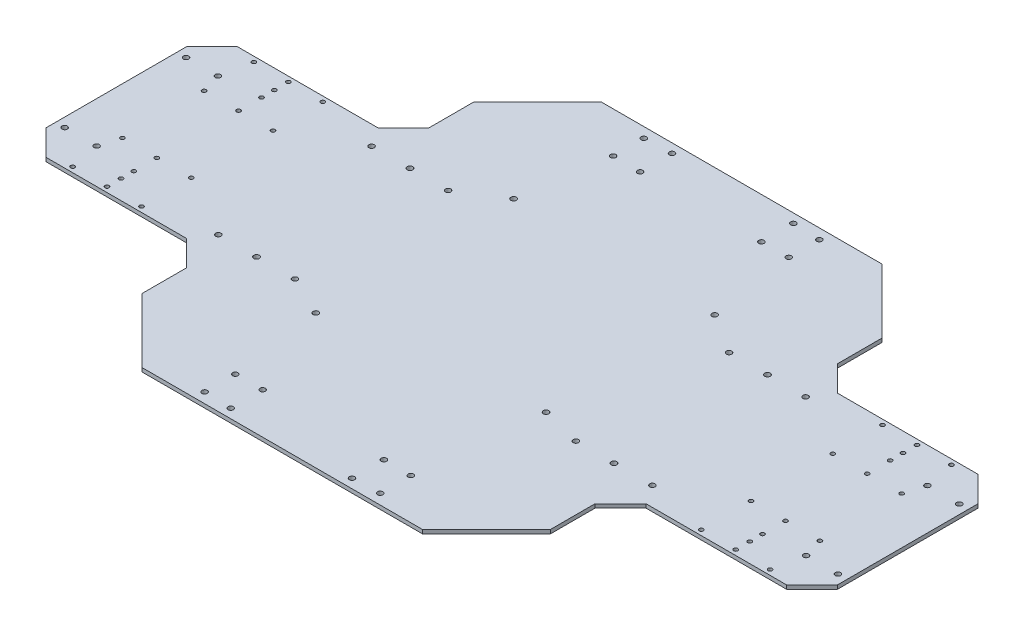
from build123d import *

# Parameters (mm, degrees)
EXTRUDE_1_DEPTH     = 3
CHAMFER_1_SIZE      = 20
SKETCH_2_W          = 320
SKETCH_2_H          = 20
CUT_EXTRUDE_1_DEPTH = 5
CHAMFER_2_SIZE      = 50
SKETCH_3_R          = 2.1
CUT_EXTRUDE_2_DEPTH = 80
SKETCH_4_R          = 2.15
CUT_EXTRUDE_3_DEPTH = 10
SKETCH_5_R          = 1.6
SKETCH_5_R_2        = 2.1
SKETCH_5_R_3        = 2.2
CUT_EXTRUDE_4_DEPTH = 29


with BuildPart() as part:
    # 草图1 → 凸台-拉伸1 (new body)
    with BuildSketch(Plane(origin=(0, 0, 0), x_dir=(1, 0, 0), z_dir=(0, 1, 0))):
        Polygon((-310, -75), (-160, -75), (-160, -200), (160, -200), (160, -75), (310, -75), (310, 75), (160, 75), (160, 200), (-160, 200), (-160, 75), (-310, 75), align=None)
    extrude(amount=EXTRUDE_1_DEPTH)

    # 倒角1
    chamfer_1_edges = [part.edges().sort_by_distance(p)[0] for p in [
        (-160, 1.5, -75),
        (-310, 1.5, -75),
        (-310, 1.5, 75),
        (-160, 1.5, 75),
        (160, 1.5, 75),
        (160, 1.5, -75),
        (310, 1.5, 75),
        (310, 1.5, -75),
    ]]
    chamfer(chamfer_1_edges, length=CHAMFER_1_SIZE)

    # 草图2 → 切除-拉伸1 (cut)
    with BuildSketch(Plane(origin=(0, 3, 0), x_dir=(1, 0, 0), z_dir=(0, 1, 0))):
        with Locations((0, 190)):
            Rectangle(SKETCH_2_W, SKETCH_2_H)
        with Locations((0, -190)):
            Rectangle(SKETCH_2_W, SKETCH_2_H)
    extrude(amount=-CUT_EXTRUDE_1_DEPTH, mode=Mode.SUBTRACT)

    # 倒角2
    chamfer_2_edges = [part.edges().sort_by_distance(p)[0] for p in [
        (-160, 1.5, -180),
        (-160, 1.5, 180),
        (160, 1.5, -180),
        (160, 1.5, 180),
    ]]
    chamfer(chamfer_2_edges, length=CHAMFER_2_SIZE)

    # 草图3 → 切除-拉伸2 (cut)
    with BuildSketch(Plane(origin=(0, 3, 0), x_dir=(1, 0, 0), z_dir=(0, 1, 0))):
        with Locations((-302.826293853, 47.5)):
            Circle(SKETCH_3_R)
        with Locations((-277.826293853, 47.5)):
            Circle(SKETCH_3_R)
        with Locations((-47.5, 172.826293853)):
            Circle(SKETCH_3_R)
        with Locations((-47.5, 147.826293853)):
            Circle(SKETCH_3_R)
        with Locations((47.5, 172.826293853)):
            Circle(SKETCH_3_R)
        with Locations((47.5, 147.826293853)):
            Circle(SKETCH_3_R)
        with Locations((277.826293853, 47.5)):
            Circle(SKETCH_3_R)
        with Locations((302.826293853, 47.5)):
            Circle(SKETCH_3_R)
        with Locations((-68.75, 172)):
            Circle(SKETCH_3_R)
        with Locations((-68.75, 148)):
            Circle(SKETCH_3_R)
        with Locations((68.75, 172)):
            Circle(SKETCH_3_R)
        with Locations((68.75, 148)):
            Circle(SKETCH_3_R)
        with Locations((68.75, -148)):
            Circle(SKETCH_3_R)
        with Locations((68.75, -172)):
            Circle(SKETCH_3_R)
        with Locations((-68.75, -148)):
            Circle(SKETCH_3_R)
        with Locations((-68.75, -172)):
            Circle(SKETCH_3_R)
        with Locations((302.826293853, -47.5)):
            Circle(SKETCH_3_R)
        with Locations((277.826293853, -47.5)):
            Circle(SKETCH_3_R)
        with Locations((47.5, -147.826293853)):
            Circle(SKETCH_3_R)
        with Locations((47.5, -172.826293853)):
            Circle(SKETCH_3_R)
        with Locations((-47.5, -147.826293853)):
            Circle(SKETCH_3_R)
        with Locations((-47.5, -172.826293853)):
            Circle(SKETCH_3_R)
        with Locations((-277.826293853, -47.5)):
            Circle(SKETCH_3_R)
        with Locations((-302.826293853, -47.5)):
            Circle(SKETCH_3_R)
    extrude(amount=-CUT_EXTRUDE_2_DEPTH, mode=Mode.SUBTRACT)

    # 草图4 → 切除-拉伸3 (cut)
    with BuildSketch(Plane.XZ):
        with Locations((-78.739999994, 74.909999989)):
            Circle(SKETCH_4_R)
        with Locations((-78.739999994, -80.01)):
            Circle(SKETCH_4_R)
        with Locations((78.740000006, -80.01)):
            Circle(SKETCH_4_R)
        with Locations((78.740000006, 52.07)):
            Circle(SKETCH_4_R)
    extrude(amount=-CUT_EXTRUDE_3_DEPTH, mode=Mode.SUBTRACT)

    # 草图5 → 切除-拉伸4 (cut)
    with BuildSketch(Plane(origin=(0, 3, 0), x_dir=(1, 0, 0), z_dir=(0, 1, 0))):
        with Locations((219.200177837, 71)):
            Circle(SKETCH_5_R)
        with Locations((273.200177837, 71)):
            Circle(SKETCH_5_R)
        with Locations((246.200177837, 71)):
            Circle(SKETCH_5_R)
        with Locations((219.200177837, 31.998400192)):
            Circle(SKETCH_5_R)
        with Locations((246.200177837, 31.998400192)):
            Circle(SKETCH_5_R)
        with Locations((273.200177837, 31.998400192)):
            Circle(SKETCH_5_R)
        with Locations((246.200177837, 60)):
            Circle(SKETCH_5_R)
        with Locations((246.200177837, 50)):
            Circle(SKETCH_5_R)
        with Locations((246.200177837, -50)):
            Circle(SKETCH_5_R)
        with Locations((246.200177837, -60)):
            Circle(SKETCH_5_R)
        with Locations((273.200177837, -31.998400192)):
            Circle(SKETCH_5_R)
        with Locations((246.200177837, -31.998400192)):
            Circle(SKETCH_5_R)
        with Locations((219.200177837, -31.998400192)):
            Circle(SKETCH_5_R)
        with Locations((246.200177837, -71)):
            Circle(SKETCH_5_R)
        with Locations((273.200177837, -71)):
            Circle(SKETCH_5_R)
        with Locations((219.200177837, -71)):
            Circle(SKETCH_5_R)
        with Locations((-219.200177837, -71)):
            Circle(SKETCH_5_R)
        with Locations((-273.200177837, -71)):
            Circle(SKETCH_5_R)
        with Locations((-246.200177837, -71)):
            Circle(SKETCH_5_R)
        with Locations((-219.200177837, -31.998400192)):
            Circle(SKETCH_5_R)
        with Locations((-246.200177837, -31.998400192)):
            Circle(SKETCH_5_R)
        with Locations((-273.200177837, -31.998400192)):
            Circle(SKETCH_5_R)
        with Locations((-246.200177837, -60)):
            Circle(SKETCH_5_R)
        with Locations((-246.200177837, -50)):
            Circle(SKETCH_5_R)
        with Locations((-246.200177837, 50)):
            Circle(SKETCH_5_R)
        with Locations((-246.200177837, 60)):
            Circle(SKETCH_5_R)
        with Locations((-273.200177837, 31.998400192)):
            Circle(SKETCH_5_R)
        with Locations((-246.200177837, 31.998400192)):
            Circle(SKETCH_5_R)
        with Locations((-219.200177837, 31.998400192)):
            Circle(SKETCH_5_R)
        with Locations((-246.200177837, 71)):
            Circle(SKETCH_5_R)
        with Locations((-273.200177837, 71)):
            Circle(SKETCH_5_R)
        with Locations((-219.200177837, 71)):
            Circle(SKETCH_5_R)
        with Locations((170, -60)):
            Circle(SKETCH_5_R_2)
        with Locations((110, -60)):
            Circle(SKETCH_5_R_2)
        with Locations((140, -60.1)):
            Circle(SKETCH_5_R_3)
        with Locations((140, 60.1)):
            Circle(SKETCH_5_R_3)
        with Locations((110, 60)):
            Circle(SKETCH_5_R_2)
        with Locations((170, 60)):
            Circle(SKETCH_5_R_2)
        with Locations((-170, 60)):
            Circle(SKETCH_5_R_2)
        with Locations((-110, 60)):
            Circle(SKETCH_5_R_2)
        with Locations((-140, 60.1)):
            Circle(SKETCH_5_R_3)
        with Locations((-140, -60.1)):
            Circle(SKETCH_5_R_3)
        with Locations((-110, -60)):
            Circle(SKETCH_5_R_2)
        with Locations((-170, -60)):
            Circle(SKETCH_5_R_2)
    extrude(amount=-CUT_EXTRUDE_4_DEPTH, mode=Mode.SUBTRACT)


solid = part.part
